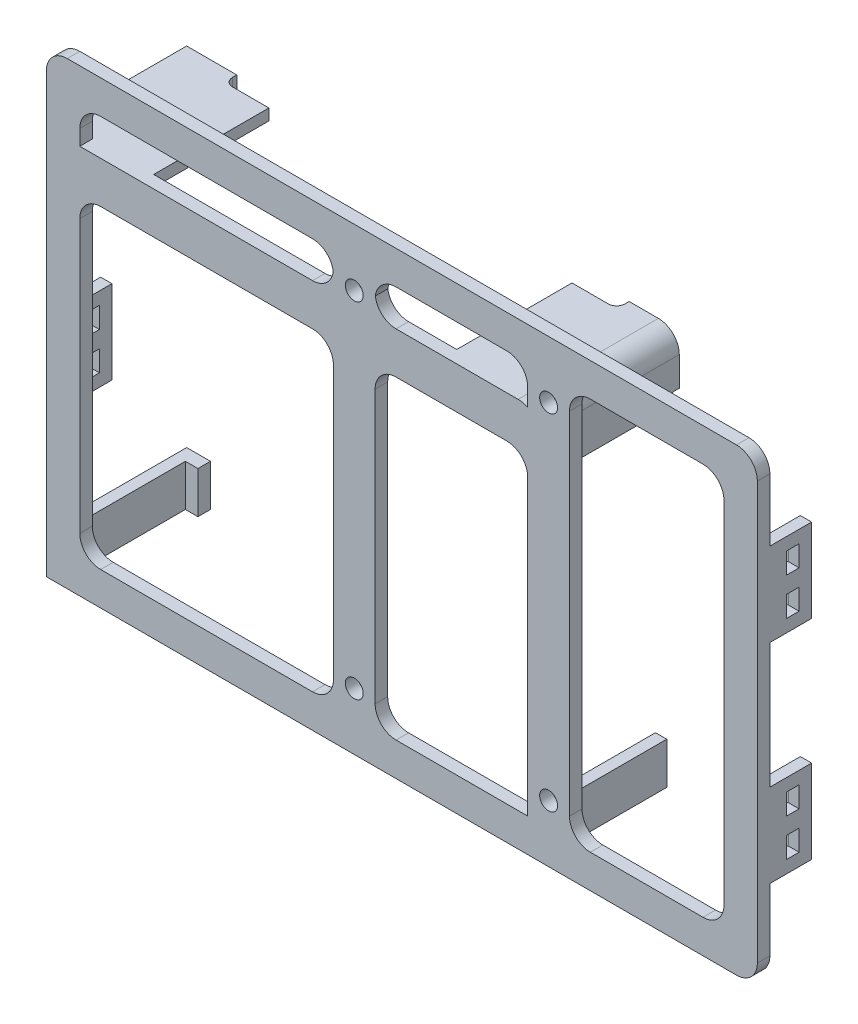
from build123d import *

# Parameters (mm, degrees)
SKETCH1_W               = 170.3
SKETCH1_H               = 110
SKETCH1_W_2             = 60.75
SKETCH1_H_2             = 75.3
SKETCH1_H_3             = 8.7
SKETCH1_W_3             = 37
SKETCH1_H_4             = 94
SKETCH1_W_4             = 36.55
BOSS_EXTRUDE1_DEPTH     = 3
F_6_CLEARANCE_HOLE1_D   = 4.3053
SKETCH6_W               = 2.7
SKETCH6_H               = 10
BOSS_EXTRUDE2_DEPTH     = 27.6
SKETCH7_W               = 5.7
SKETCH7_H               = 10
BOSS_EXTRUDE3_DEPTH     = 3
FILLET3_R               = 5
FILLET4_R               = 2
FILLET5_R               = 5
SKETCH8_W               = 2.7
SKETCH8_H               = 20
BOSS_EXTRUDE4_DEPTH     = 10
CUT_EXTRUDE1_DEPTH      = 206.032802254
CUT_EXTRUDE1_DEPTH_BACK = 3
SKETCH9_W               = 3
SKETCH9_H               = 5
SKETCH11_W              = 2.7
SKETCH11_H              = 20
BOSS_EXTRUDE5_DEPTH     = 10
SKETCH12_W              = 3
SKETCH12_H              = 5
CUT_EXTRUDE2_DEPTH      = 3


with BuildPart() as part:
    # Sketch1 → Boss-Extrude1 (new body)
    with BuildSketch(Plane.XY):
        with Locations((85.15, 55)):
            Rectangle(SKETCH1_W, SKETCH1_H)
        with Locations((38.375, 45.65)):
            Rectangle(SKETCH1_W_2, SKETCH1_H_2, mode=Mode.SUBTRACT)
        with Locations((38.375, 97.65)):
            Rectangle(SKETCH1_W_2, SKETCH1_H_3, mode=Mode.SUBTRACT)
        with Locations((143.8, 55)):
            Rectangle(SKETCH1_W_3, SKETCH1_H_4, mode=Mode.SUBTRACT)
        with Locations((97.025, 45.65)):
            Rectangle(SKETCH1_W_4, SKETCH1_H_2, mode=Mode.SUBTRACT)
        with Locations((97.025, 97.65)):
            Rectangle(SKETCH1_W_4, SKETCH1_H_3, mode=Mode.SUBTRACT)
    extrude(amount=BOSS_EXTRUDE1_DEPTH)

    # #6 Clearance Hole1 (through all)
    with Locations(Plane(origin=(0, 0, 0), x_dir=(-1, 0, 0), z_dir=(0, 0, -1))):
        with Locations((-120.3, 13.725), (-120.3, 96.275), (-73.75, 13.725), (-73.75, 96.275)):
            Hole(F_6_CLEARANCE_HOLE1_D / 2)

    # Sketch6 → Boss-Extrude2 (add)
    with BuildSketch(Plane(origin=(0, 0, 0), x_dir=(-1, 0, 0), z_dir=(0, 0, -1))):
        with Locations((-1.35, 5)):
            Rectangle(SKETCH6_W, SKETCH6_H)
        with Locations((-116.65, 5)):
            Rectangle(SKETCH6_W, SKETCH6_H)
        Polygon((0, 81.3), (0, 93.3), (-22.7, 93.3), (-22.7, 90.6), (-2.7, 90.6), (-2.7, 81.3), align=None)
        Polygon((-95.3, 93.3), (-118, 93.3), (-118, 78.6), (-115.3, 78.6), (-115.3, 90.6), (-95.3, 90.6), align=None)
    extrude(amount=BOSS_EXTRUDE2_DEPTH)

    # Sketch7 → Boss-Extrude3 (add)
    with BuildSketch(Plane(origin=(0, 0, -27.6), x_dir=(-1, 0, 0), z_dir=(0, 0, -1))):
        Polygon((0, 93.3), (0, 81.3), (-5.7, 81.3), (-5.7, 87.6), (-12, 87.6), (-12, 93.3), align=None)
        with Locations((-2.85, 5)):
            Rectangle(SKETCH7_W, SKETCH7_H)
        Polygon((-118, 93.3), (-118, 81.3), (-112.3, 81.3), (-112.3, 87.6), (-106, 87.6), (-106, 93.3), align=None)
    extrude(amount=BOSS_EXTRUDE3_DEPTH)

    # Fillet3
    fillet3_edges = [part.edges().sort_by_distance(p)[0] for p in [
        (118, 93.3, -15.3),
    ]]
    fillet(fillet3_edges, radius=FILLET3_R)

    # Fillet4
    fillet4_edges = [part.edges().sort_by_distance(p)[0] for p in [
        (12, 91.95, -27.6),
        (106, 91.95, -27.6),
        (116.65, 81.3, -27.6),
    ]]
    fillet(fillet4_edges, radius=FILLET4_R)

    # Fillet5
    # the kernel refuses this fillet: 5 mm, written as the material it adds along each edge
    with BuildSketch(Plane(origin=(8, 83.3, 0), x_dir=(0, -1, 0), z_dir=(0, 0, 1)), Plane(origin=(68.75, 83.3, 0), x_dir=(-1, 0, 0), z_dir=(0, 0, 1)), Plane(origin=(125.3, 102, 0), x_dir=(0, -1, 0), z_dir=(0, 0, 1)), Plane(origin=(125.3, 8, 0), x_dir=(1, 0, 0), z_dir=(0, 0, 1)), Plane(origin=(68.75, 93.3, 0), x_dir=(0, 1, 0), z_dir=(0, 0, 1)), Plane(origin=(68.75, 102, 0), x_dir=(-1, 0, 0), z_dir=(0, 0, 1)), Plane(origin=(78.75, 8, 0), x_dir=(1, 0, 0), z_dir=(0, 0, 1)), Plane(origin=(78.75, 102, 0), x_dir=(0, -1, 0), z_dir=(0, 0, 1)), Plane(origin=(78.75, 93.3, 0), x_dir=(1, 0, 0), z_dir=(0, 0, 1))) as fillet5_piece_1:
        with BuildLine():
            CenterArc((FILLET5_R, FILLET5_R), FILLET5_R, 180, 90)
            Line((0, FILLET5_R), (0, 0))
            Line((0, 0), (FILLET5_R, 0))
        make_face()
    extrude(amount=3)
    with BuildSketch(Plane(origin=(8, 8, 0), x_dir=(0, 1, 0), z_dir=(0, 0, 1)), Plane(origin=(68.75, 8, 0), x_dir=(-1, 0, 0), z_dir=(0, 0, 1)), Plane(origin=(162.3, 102, 0), x_dir=(0, -1, 0), z_dir=(0, 0, 1)), Plane(origin=(162.3, 8, 0), x_dir=(-1, 0, 0), z_dir=(0, 0, 1)), Plane(origin=(8, 102, 0), x_dir=(1, 0, 0), z_dir=(0, 0, 1)), Plane(origin=(115.3, 83.3, 0), x_dir=(0, -1, 0), z_dir=(0, 0, 1)), Plane(origin=(78.75, 83.3, 0), x_dir=(1, 0, 0), z_dir=(0, 0, 1)), Plane(origin=(115.3, 102, 0), x_dir=(0, -1, 0), z_dir=(0, 0, 1))) as fillet5_piece_2:
        with BuildLine():
            CenterArc((FILLET5_R, -FILLET5_R), FILLET5_R, 90, 90)
            Line((0, -FILLET5_R), (0, 0))
            Line((0, 0), (FILLET5_R, 0))
        make_face()
    extrude(amount=3)
    # the kernel refuses this fillet: 5 mm, written as the material it takes off along each edge
    with BuildSketch(Plane(origin=(0, 110, -12.5), x_dir=(0, -1, 0), z_dir=(0, 0, 1)), Plane(origin=(170.3, 110, -12.5), x_dir=(-1, 0, 0), z_dir=(0, 0, 1)), Plane(origin=(170.3, 0, -12.5), x_dir=(0, 1, 0), z_dir=(0, 0, 1))) as fillet5_2_piece_1:
        with BuildLine():
            CenterArc((FILLET5_R, FILLET5_R), FILLET5_R, 180, 90)
            Line((0, FILLET5_R), (0, 0))
            Line((0, 0), (FILLET5_R, 0))
        make_face()
    extrude(amount=28, mode=Mode.SUBTRACT)

    # Sketch8 → Boss-Extrude4 (add)
    with BuildSketch(Plane(origin=(0, 0, 0), x_dir=(-1, 0, 0), z_dir=(0, 0, -1))):
        with Locations((-1.35, 45.65)):
            Rectangle(SKETCH8_W, SKETCH8_H)
    extrude(amount=BOSS_EXTRUDE4_DEPTH)

    # Sketch9 → Cut-Extrude1 (cut, two sides: drawn at the far end of the back side and taken through both)
    with BuildSketch(Plane.ZY.offset(-CUT_EXTRUDE1_DEPTH_BACK)):
        with Locations((-5.5, 41.15)):
            Rectangle(SKETCH9_W, SKETCH9_H)
        with Locations((-5.5, 50.15)):
            Rectangle(SKETCH9_W, SKETCH9_H)
    extrude(amount=CUT_EXTRUDE1_DEPTH + CUT_EXTRUDE1_DEPTH_BACK, mode=Mode.SUBTRACT)

    # Sketch11 → Boss-Extrude5 (add)
    with BuildSketch(Plane(origin=(0, 0, 0), x_dir=(-1, 0, 0), z_dir=(0, 0, -1))):
        with Locations((-168.95, 30)):
            Rectangle(SKETCH11_W, SKETCH11_H)
        with Locations((-168.95, 80)):
            Rectangle(SKETCH11_W, SKETCH11_H)
    extrude(amount=BOSS_EXTRUDE5_DEPTH)

    # Sketch12 → Cut-Extrude2 (cut)
    with BuildSketch(Plane(origin=(170.3, 0, 0), x_dir=(0, 0, -1), z_dir=(1, 0, 0))):
        with Locations((5.5, 34.5)):
            Rectangle(SKETCH12_W, SKETCH12_H)
        with Locations((5.5, 25.5)):
            Rectangle(SKETCH12_W, SKETCH12_H)
        with Locations((5.5, 84.5)):
            Rectangle(SKETCH12_W, SKETCH12_H)
        with Locations((5.5, 75.5)):
            Rectangle(SKETCH12_W, SKETCH12_H)
    extrude(amount=-CUT_EXTRUDE2_DEPTH, mode=Mode.SUBTRACT)


solid = part.part
